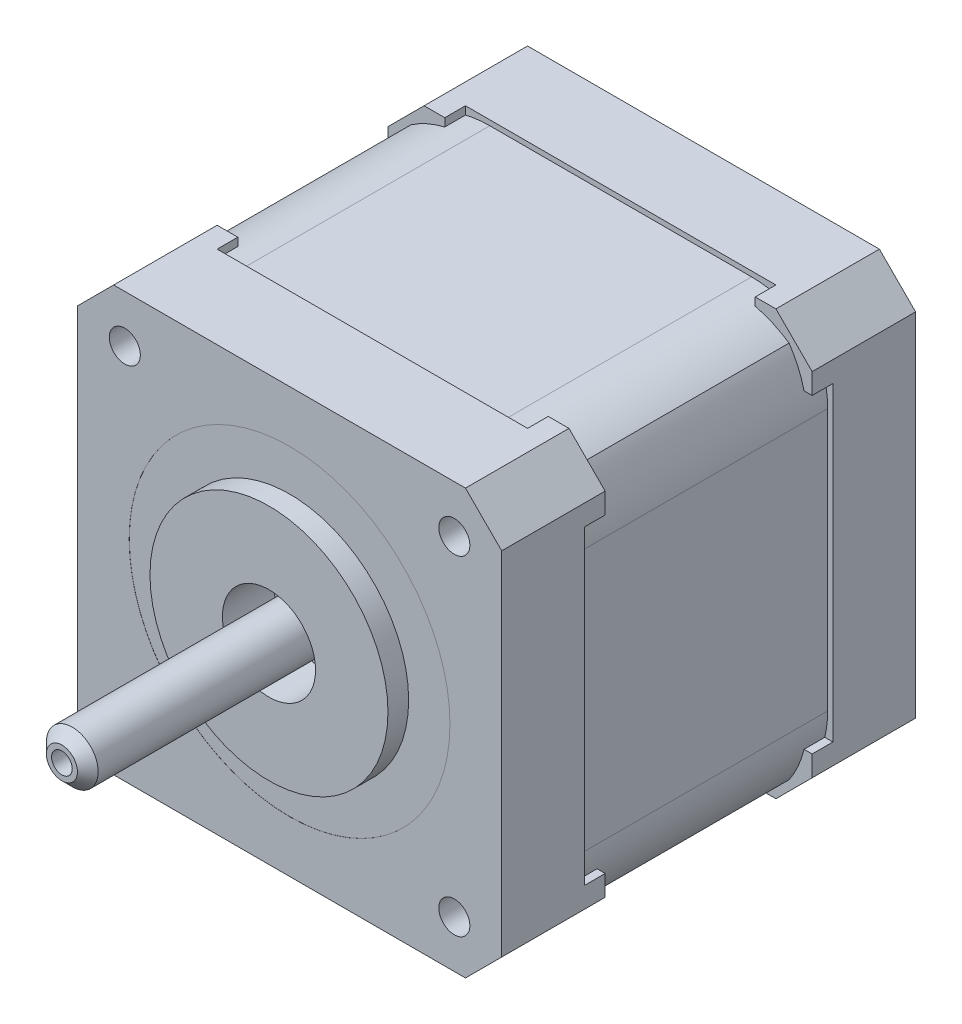
from build123d import *

# Parameters (mm, degrees)
Y_KSEKLIK_EKSTR_ZYON2_DEPTH  = 8
Y_KSEKLIK_EKSTR_ZYON10_DEPTH = 2
Y_KSEKLIK_EKSTR_ZYON11_DEPTH = 24
Y_KSEKLIK_EKSTR_ZYON12_DEPTH = 8
Y_KSEKLIK_EKSTR_ZYON14_DEPTH = 2
RADYUS5_R                    = 10
IZIM15_R                     = 4.5
KES_EKSTR_ZYON3_DEPTH        = 3
RADYUS6_R                    = 0.5
IZIM16_R                     = 3
Y_KSEKLIK_EKSTR_ZYON15_DEPTH = 1
RADYUS7_R                    = 0.5
KES_EKSTR_ZYON4_DEPTH        = 0.5
IZIM18_R                     = 3
KES_EKSTR_ZYON5_DEPTH        = 1
IZIM19_R                     = 2
Y_KSEKLIK_EKSTR_ZYON17_DEPTH = 0.5
RADYUS8_R                    = 0.5
KES_EKSTR_ZYON6_DEPTH        = 0.1
KES_EKSTR_ZYON7_START        = -3
IZIM22_R                     = 4.5
KES_EKSTR_ZYON7_DEPTH        = 3
IZIM23_R                     = 2.5
Y_KSEKLIK_EKSTR_ZYON18_DEPTH = 25
IZIM24_R                     = 1
KES_EKSTR_ZYON8_DEPTH        = 2
PAH1_SIZE                    = 1
KES_EKSTR_ZYON9_START        = -0.01
IZIM25_R                     = 15.5
IZIM25_R_2                   = 4.5
KES_EKSTR_ZYON9_DEPTH        = 0.01
IZIM26_R                     = 11.5
IZIM26_R_2                   = 4.5
Y_KSEKLIK_EKSTR_ZYON19_DEPTH = 2
IZIM28_R                     = 1.5
KES_EKSTR_ZYON10_DEPTH       = 6


# Some blends are built 0.0001 mm under size
with BuildPart() as part:
    # Çizim1 → Yükseklik-Ekstrüzyon2 (new body)
    with BuildSketch(Plane.XY):
        Polygon((-17, 41), (17, 41), (20.5, 37.5), (20.5, 3.5), (17, 0), (-17, 0), (-20.5, 3.5), (-20.5, 37.5), align=None)
    extrude(amount=Y_KSEKLIK_EKSTR_ZYON2_DEPTH)

    # Çizim5 → Yükseklik-Ekstrüzyon10 (add)
    with BuildSketch(Plane(origin=(0, 0, 0), x_dir=(-1, 0, 0), z_dir=(0, 0, -1))):
        Polygon((-20.5, 37.5), (-20.5, 35.5), (-20, 35.5), (-20, 37.292893219), (-16.792893219, 40.5), (-15, 40.5), (-15, 41), (-17, 41), align=None)
        Polygon((17, 41), (15, 41), (15, 40.5), (16.792893219, 40.5), (20, 37.292893219), (20, 35.5), (20.5, 35.5), (20.5, 37.5), align=None)
        Polygon((15, 0.5), (15, 0), (17, 0), (20.5, 3.5), (20.5, 5.5), (20, 5.5), (20, 3.707106781), (16.792893219, 0.5), align=None)
        Polygon((-20.5, 5.5), (-20.5, 3.5), (-17, 0), (-15, 0), (-15, 0.5), (-16.792893219, 0.5), (-20, 3.707106781), (-20, 5.5), align=None)
    extrude(amount=Y_KSEKLIK_EKSTR_ZYON10_DEPTH)

    # Çizim12 → Yükseklik-Ekstrüzyon11 (add)
    with BuildSketch(Plane(origin=(0, 0, 0), x_dir=(-1, 0, 0), z_dir=(0, 0, -1))):
        Polygon((-20, 37.292893219), (-20, 35.5), (-20, 5.5), (-20, 3.707106781), (-16.792893219, 0.5), (-15, 0.5), (15, 0.5), (16.792893219, 0.5), (20, 3.707106781), (20, 5.5), (20, 35.5), (20, 37.292893219), (16.792893219, 40.5), (15, 40.5), (-15, 40.5), (-16.792893219, 40.5), align=None)
    extrude(amount=Y_KSEKLIK_EKSTR_ZYON11_DEPTH)

    # Çizim13 → Yükseklik-Ekstrüzyon12 (add)
    with BuildSketch(Plane(origin=(0, 0, -24), x_dir=(-1, 0, 0), z_dir=(0, 0, -1))):
        Polygon((-17, 41), (-20.5, 37.5), (-20.5, 3.5), (-17, 0), (17, 0), (20.5, 3.5), (20.5, 37.5), (17, 41), align=None)
    extrude(amount=Y_KSEKLIK_EKSTR_ZYON12_DEPTH)

    # Çizim14 → Yükseklik-Ekstrüzyon14 (add)
    with BuildSketch(Plane.XY.offset(-24)):
        Polygon((-15, 40.5), (-15, 41), (-17, 41), (-20.5, 37.5), (-20.5, 35.5), (-20, 35.5), (-20, 37.292893219), (-16.792893219, 40.5), align=None)
        Polygon((-20, 5.5), (-20.5, 5.5), (-20.5, 3.5), (-17, 0), (-15, 0), (-15, 0.5), (-16.792893219, 0.5), (-20, 3.707106781), align=None)
        Polygon((20.5, 3.5), (20.5, 5.5), (20, 5.5), (20, 3.707106781), (16.792893219, 0.5), (15, 0.5), (15, 0), (17, 0), align=None)
        Polygon((20.5, 37.5), (17, 41), (15, 41), (15, 40.5), (16.792893219, 40.5), (20, 37.292893219), (20, 35.5), (20.5, 35.5), align=None)
    extrude(amount=Y_KSEKLIK_EKSTR_ZYON14_DEPTH)

    # Radyus5
    # the kernel refuses this fillet: 10 mm, written as the material it takes off along each edge
    with BuildSketch(Plane(origin=(-16.792893219, 0.5, 8.355339059), x_dir=(-0.7071067811865476, 0.7071067811865476, 0), z_dir=(0, 0, -1))) as radyus5_piece_1_section:
        with BuildLine():
            CenterArc((RADYUS5_R * 0.414213562373, RADYUS5_R), RADYUS5_R, 225, 45)
            Line((-RADYUS5_R * 0.292893218813, RADYUS5_R * 0.292893218813), (0, 0))
            Line((0, 0), (RADYUS5_R * 0.414213562373, 0))
        make_face()
    radyus5_piece_1 = extrude(amount=30.355339059, mode=Mode.PRIVATE)
    radyus5_piece_1 = split(radyus5_piece_1, bisect_by=Plane(origin=(-15, 0.458221374, -1), z_dir=(1, 0, 0)), keep=Keep.TOP, mode=Mode.PRIVATE)
    radyus5_piece_1 = split(radyus5_piece_1, bisect_by=Plane(origin=(-14.011989835, 0.458221374, -2), z_dir=(0, 0, 1)), keep=Keep.TOP, mode=Mode.PRIVATE)
    radyus5_piece_1 = split(radyus5_piece_1, bisect_by=Plane(origin=(-14.011989835, 0.458221374, 0), z_dir=(0, 0, -1)), keep=Keep.TOP, mode=Mode.PRIVATE)
    add(radyus5_piece_1, mode=Mode.SUBTRACT)
    with BuildSketch(Plane(origin=(-16.792893219, 0.5, -2), x_dir=(-0.7071067811865476, 0.7071067811865476, 0), z_dir=(0, 0, -1))) as radyus5_piece_2_section:
        with BuildLine():
            CenterArc((RADYUS5_R * 0.414213562373, RADYUS5_R), RADYUS5_R, 225, 45)
            Line((-RADYUS5_R * 0.292893218813, RADYUS5_R * 0.292893218813), (0, 0))
            Line((0, 0), (RADYUS5_R * 0.414213562373, 0))
        make_face()
    radyus5_piece_2 = extrude(amount=20, mode=Mode.PRIVATE)
    radyus5_piece_2 = split(radyus5_piece_2, bisect_by=Plane(origin=(-15, 1.262769888, -12), z_dir=(-1, 0, 0)), keep=Keep.TOP, mode=Mode.PRIVATE)
    add(radyus5_piece_2, mode=Mode.SUBTRACT)
    with BuildSketch(Plane(origin=(-16.792893219, 0.5, -2), x_dir=(-0.7071067811865476, 0.7071067811865476, 0), z_dir=(0, 0, -1))) as radyus5_piece_3_section:
        with BuildLine():
            CenterArc((RADYUS5_R * 0.414213562373, RADYUS5_R), RADYUS5_R, 225, 45)
            Line((-RADYUS5_R * 0.292893218813, RADYUS5_R * 0.292893218813), (0, 0))
            Line((0, 0), (RADYUS5_R * 0.414213562373, 0))
        make_face()
    radyus5_piece_3 = extrude(amount=20, mode=Mode.PRIVATE)
    radyus5_piece_3 = split(radyus5_piece_3, bisect_by=Plane(origin=(-15, 0.458221374, -12), z_dir=(1, 0, 0)), keep=Keep.TOP, mode=Mode.PRIVATE)
    add(radyus5_piece_3, mode=Mode.SUBTRACT)
    with BuildSketch(Plane(origin=(-16.792893219, 0.5, -2), x_dir=(-0.7071067811865476, 0.7071067811865476, 0), z_dir=(0, 0, -1))) as radyus5_piece_4_section:
        with BuildLine():
            CenterArc((RADYUS5_R * 0.414213562373, RADYUS5_R), RADYUS5_R, 225, 45)
            Line((-RADYUS5_R * 0.292893218813, RADYUS5_R * 0.292893218813), (0, 0))
            Line((0, 0), (RADYUS5_R * 0.414213562373, 0))
        make_face()
    radyus5_piece_4 = extrude(amount=30.355339059, mode=Mode.PRIVATE)
    radyus5_piece_4 = split(radyus5_piece_4, bisect_by=Plane(origin=(-14.011989835, 0.458221374, -24), z_dir=(0, 0, 1)), keep=Keep.TOP, mode=Mode.PRIVATE)
    radyus5_piece_4 = split(radyus5_piece_4, bisect_by=Plane(origin=(-15, 0.458221374, -23), z_dir=(1, 0, 0)), keep=Keep.TOP, mode=Mode.PRIVATE)
    radyus5_piece_4 = split(radyus5_piece_4, bisect_by=Plane(origin=(-14.011989835, 0.458221374, -22), z_dir=(0, 0, -1)), keep=Keep.TOP, mode=Mode.PRIVATE)
    add(radyus5_piece_4, mode=Mode.SUBTRACT)
    with BuildSketch(Plane(origin=(-20, 3.707106781, 8.355339059), x_dir=(0, 1, 0), z_dir=(0, 0, -1))) as radyus5_piece_5_section:
        with BuildLine():
            CenterArc((RADYUS5_R * 0.414213562373, RADYUS5_R), RADYUS5_R, 225, 45)
            Line((-RADYUS5_R * 0.292893218813, RADYUS5_R * 0.292893218813), (0, 0))
            Line((0, 0), (RADYUS5_R * 0.414213562373, 0))
        make_face()
    radyus5_piece_5 = extrude(amount=30.355339059, mode=Mode.PRIVATE)
    radyus5_piece_5 = split(radyus5_piece_5, bisect_by=Plane(origin=(-20.041778626, 6.488010165, -2), z_dir=(0, 0, 1)), keep=Keep.TOP, mode=Mode.PRIVATE)
    radyus5_piece_5 = split(radyus5_piece_5, bisect_by=Plane(origin=(-20.041778626, 5.5, -1), z_dir=(0, 1, 0)), keep=Keep.TOP, mode=Mode.PRIVATE)
    radyus5_piece_5 = split(radyus5_piece_5, bisect_by=Plane(origin=(-20.041778626, 6.488010165, 0), z_dir=(0, 0, -1)), keep=Keep.TOP, mode=Mode.PRIVATE)
    add(radyus5_piece_5, mode=Mode.SUBTRACT)
    with BuildSketch(Plane(origin=(-20, 3.707106781, -2), x_dir=(0, 1, 0), z_dir=(0, 0, -1))) as radyus5_piece_6_section:
        with BuildLine():
            CenterArc((RADYUS5_R * 0.414213562373, RADYUS5_R), RADYUS5_R, 225, 45)
            Line((-RADYUS5_R * 0.292893218813, RADYUS5_R * 0.292893218813), (0, 0))
            Line((0, 0), (RADYUS5_R * 0.414213562373, 0))
        make_face()
    radyus5_piece_6 = extrude(amount=20, mode=Mode.PRIVATE)
    radyus5_piece_6 = split(radyus5_piece_6, bisect_by=Plane(origin=(-20.041778626, 5.5, -12), z_dir=(0, 1, 0)), keep=Keep.TOP, mode=Mode.PRIVATE)
    add(radyus5_piece_6, mode=Mode.SUBTRACT)
    with BuildSketch(Plane(origin=(-20, 3.707106781, -2), x_dir=(0, 1, 0), z_dir=(0, 0, -1))) as radyus5_piece_7_section:
        with BuildLine():
            CenterArc((RADYUS5_R * 0.414213562373, RADYUS5_R), RADYUS5_R, 225, 45)
            Line((-RADYUS5_R * 0.292893218813, RADYUS5_R * 0.292893218813), (0, 0))
            Line((0, 0), (RADYUS5_R * 0.414213562373, 0))
        make_face()
    radyus5_piece_7 = extrude(amount=20, mode=Mode.PRIVATE)
    radyus5_piece_7 = split(radyus5_piece_7, bisect_by=Plane(origin=(-19.237230112, 5.5, -12), z_dir=(0, -1, 0)), keep=Keep.TOP, mode=Mode.PRIVATE)
    add(radyus5_piece_7, mode=Mode.SUBTRACT)
    with BuildSketch(Plane(origin=(-20, 3.707106781, -2), x_dir=(0, 1, 0), z_dir=(0, 0, -1))) as radyus5_piece_8_section:
        with BuildLine():
            CenterArc((RADYUS5_R * 0.414213562373, RADYUS5_R), RADYUS5_R, 225, 45)
            Line((-RADYUS5_R * 0.292893218813, RADYUS5_R * 0.292893218813), (0, 0))
            Line((0, 0), (RADYUS5_R * 0.414213562373, 0))
        make_face()
    radyus5_piece_8 = extrude(amount=30.355339059, mode=Mode.PRIVATE)
    radyus5_piece_8 = split(radyus5_piece_8, bisect_by=Plane(origin=(-20.041778626, 6.488010165, -22), z_dir=(0, 0, -1)), keep=Keep.TOP, mode=Mode.PRIVATE)
    radyus5_piece_8 = split(radyus5_piece_8, bisect_by=Plane(origin=(-20.041778626, 6.488010165, -24), z_dir=(0, 0, 1)), keep=Keep.TOP, mode=Mode.PRIVATE)
    radyus5_piece_8 = split(radyus5_piece_8, bisect_by=Plane(origin=(-20.041778626, 5.5, -23), z_dir=(0, 1, 0)), keep=Keep.TOP, mode=Mode.PRIVATE)
    add(radyus5_piece_8, mode=Mode.SUBTRACT)
    with BuildSketch(Plane(origin=(-20, 37.292893219, 8.355339059), x_dir=(0.7071067811865476, 0.7071067811865476, 0), z_dir=(0, 0, -1))) as radyus5_piece_9_section:
        with BuildLine():
            CenterArc((RADYUS5_R * 0.414213562373, RADYUS5_R), RADYUS5_R, 225, 45)
            Line((-RADYUS5_R * 0.292893218813, RADYUS5_R * 0.292893218813), (0, 0))
            Line((0, 0), (RADYUS5_R * 0.414213562373, 0))
        make_face()
    radyus5_piece_9 = extrude(amount=30.355339059, mode=Mode.PRIVATE)
    radyus5_piece_9 = split(radyus5_piece_9, bisect_by=Plane(origin=(-20.041778626, 35.5, -1), z_dir=(0, -1, 0)), keep=Keep.TOP, mode=Mode.PRIVATE)
    radyus5_piece_9 = split(radyus5_piece_9, bisect_by=Plane(origin=(-20.041778626, 34.511989835, -2), z_dir=(0, 0, 1)), keep=Keep.TOP, mode=Mode.PRIVATE)
    radyus5_piece_9 = split(radyus5_piece_9, bisect_by=Plane(origin=(-20.041778626, 34.511989835, 0), z_dir=(0, 0, -1)), keep=Keep.TOP, mode=Mode.PRIVATE)
    add(radyus5_piece_9, mode=Mode.SUBTRACT)
    with BuildSketch(Plane(origin=(-20, 37.292893219, -2), x_dir=(0.7071067811865476, 0.7071067811865476, 0), z_dir=(0, 0, -1))) as radyus5_piece_10_section:
        with BuildLine():
            CenterArc((RADYUS5_R * 0.414213562373, RADYUS5_R), RADYUS5_R, 225, 45)
            Line((-RADYUS5_R * 0.292893218813, RADYUS5_R * 0.292893218813), (0, 0))
            Line((0, 0), (RADYUS5_R * 0.414213562373, 0))
        make_face()
    radyus5_piece_10 = extrude(amount=20, mode=Mode.PRIVATE)
    radyus5_piece_10 = split(radyus5_piece_10, bisect_by=Plane(origin=(-19.237230112, 35.5, -12), z_dir=(0, 1, 0)), keep=Keep.TOP, mode=Mode.PRIVATE)
    add(radyus5_piece_10, mode=Mode.SUBTRACT)
    with BuildSketch(Plane(origin=(-20, 37.292893219, -2), x_dir=(0.7071067811865476, 0.7071067811865476, 0), z_dir=(0, 0, -1))) as radyus5_piece_11_section:
        with BuildLine():
            CenterArc((RADYUS5_R * 0.414213562373, RADYUS5_R), RADYUS5_R, 225, 45)
            Line((-RADYUS5_R * 0.292893218813, RADYUS5_R * 0.292893218813), (0, 0))
            Line((0, 0), (RADYUS5_R * 0.414213562373, 0))
        make_face()
    radyus5_piece_11 = extrude(amount=20, mode=Mode.PRIVATE)
    radyus5_piece_11 = split(radyus5_piece_11, bisect_by=Plane(origin=(-20.041778626, 35.5, -12), z_dir=(0, -1, 0)), keep=Keep.TOP, mode=Mode.PRIVATE)
    add(radyus5_piece_11, mode=Mode.SUBTRACT)
    with BuildSketch(Plane(origin=(-20, 37.292893219, -2), x_dir=(0.7071067811865476, 0.7071067811865476, 0), z_dir=(0, 0, -1))) as radyus5_piece_12_section:
        with BuildLine():
            CenterArc((RADYUS5_R * 0.414213562373, RADYUS5_R), RADYUS5_R, 225, 45)
            Line((-RADYUS5_R * 0.292893218813, RADYUS5_R * 0.292893218813), (0, 0))
            Line((0, 0), (RADYUS5_R * 0.414213562373, 0))
        make_face()
    radyus5_piece_12 = extrude(amount=30.355339059, mode=Mode.PRIVATE)
    radyus5_piece_12 = split(radyus5_piece_12, bisect_by=Plane(origin=(-20.041778626, 34.511989835, -24), z_dir=(0, 0, 1)), keep=Keep.TOP, mode=Mode.PRIVATE)
    radyus5_piece_12 = split(radyus5_piece_12, bisect_by=Plane(origin=(-20.041778626, 35.5, -23), z_dir=(0, -1, 0)), keep=Keep.TOP, mode=Mode.PRIVATE)
    radyus5_piece_12 = split(radyus5_piece_12, bisect_by=Plane(origin=(-20.041778626, 34.511989835, -22), z_dir=(0, 0, -1)), keep=Keep.TOP, mode=Mode.PRIVATE)
    add(radyus5_piece_12, mode=Mode.SUBTRACT)
    with BuildSketch(Plane(origin=(-16.792893219, 40.5, 8.355339059), x_dir=(-0.7071067811865476, -0.7071067811865476, 0), z_dir=(0, 0, -1))) as radyus5_piece_13_section:
        with BuildLine():
            CenterArc((RADYUS5_R * 0.414213562373, -RADYUS5_R), RADYUS5_R, 90, 45)
            Line((-RADYUS5_R * 0.292893218813, -RADYUS5_R * 0.292893218813), (0, 0))
            Line((0, 0), (RADYUS5_R * 0.414213562373, 0))
        make_face()
    radyus5_piece_13 = extrude(amount=30.355339059, mode=Mode.PRIVATE)
    radyus5_piece_13 = split(radyus5_piece_13, bisect_by=Plane(origin=(-14.011989835, 40.541778626, -2), z_dir=(0, 0, 1)), keep=Keep.TOP, mode=Mode.PRIVATE)
    radyus5_piece_13 = split(radyus5_piece_13, bisect_by=Plane(origin=(-14.011989835, 40.541778626, 0), z_dir=(0, 0, -1)), keep=Keep.TOP, mode=Mode.PRIVATE)
    radyus5_piece_13 = split(radyus5_piece_13, bisect_by=Plane(origin=(-15, 40.541778626, -1), z_dir=(1, 0, 0)), keep=Keep.TOP, mode=Mode.PRIVATE)
    add(radyus5_piece_13, mode=Mode.SUBTRACT)
    with BuildSketch(Plane(origin=(-16.792893219, 40.5, -2), x_dir=(-0.7071067811865476, -0.7071067811865476, 0), z_dir=(0, 0, -1))) as radyus5_piece_14_section:
        with BuildLine():
            CenterArc((RADYUS5_R * 0.414213562373, -RADYUS5_R), RADYUS5_R, 90, 45)
            Line((-RADYUS5_R * 0.292893218813, -RADYUS5_R * 0.292893218813), (0, 0))
            Line((0, 0), (RADYUS5_R * 0.414213562373, 0))
        make_face()
    radyus5_piece_14 = extrude(amount=20, mode=Mode.PRIVATE)
    radyus5_piece_14 = split(radyus5_piece_14, bisect_by=Plane(origin=(-15, 39.737230112, -12), z_dir=(-1, 0, 0)), keep=Keep.TOP, mode=Mode.PRIVATE)
    add(radyus5_piece_14, mode=Mode.SUBTRACT)
    with BuildSketch(Plane(origin=(-16.792893219, 40.5, -2), x_dir=(-0.7071067811865476, -0.7071067811865476, 0), z_dir=(0, 0, -1))) as radyus5_piece_15_section:
        with BuildLine():
            CenterArc((RADYUS5_R * 0.414213562373, -RADYUS5_R), RADYUS5_R, 90, 45)
            Line((-RADYUS5_R * 0.292893218813, -RADYUS5_R * 0.292893218813), (0, 0))
            Line((0, 0), (RADYUS5_R * 0.414213562373, 0))
        make_face()
    radyus5_piece_15 = extrude(amount=20, mode=Mode.PRIVATE)
    radyus5_piece_15 = split(radyus5_piece_15, bisect_by=Plane(origin=(-15, 40.541778626, -12), z_dir=(1, 0, 0)), keep=Keep.TOP, mode=Mode.PRIVATE)
    add(radyus5_piece_15, mode=Mode.SUBTRACT)
    with BuildSketch(Plane(origin=(-16.792893219, 40.5, -2), x_dir=(-0.7071067811865476, -0.7071067811865476, 0), z_dir=(0, 0, -1))) as radyus5_piece_16_section:
        with BuildLine():
            CenterArc((RADYUS5_R * 0.414213562373, -RADYUS5_R), RADYUS5_R, 90, 45)
            Line((-RADYUS5_R * 0.292893218813, -RADYUS5_R * 0.292893218813), (0, 0))
            Line((0, 0), (RADYUS5_R * 0.414213562373, 0))
        make_face()
    radyus5_piece_16 = extrude(amount=30.355339059, mode=Mode.PRIVATE)
    radyus5_piece_16 = split(radyus5_piece_16, bisect_by=Plane(origin=(-14.011989835, 40.541778626, -22), z_dir=(0, 0, -1)), keep=Keep.TOP, mode=Mode.PRIVATE)
    radyus5_piece_16 = split(radyus5_piece_16, bisect_by=Plane(origin=(-15, 40.541778626, -23), z_dir=(1, 0, 0)), keep=Keep.TOP, mode=Mode.PRIVATE)
    radyus5_piece_16 = split(radyus5_piece_16, bisect_by=Plane(origin=(-14.011989835, 40.541778626, -24), z_dir=(0, 0, 1)), keep=Keep.TOP, mode=Mode.PRIVATE)
    add(radyus5_piece_16, mode=Mode.SUBTRACT)
    with BuildSketch(Plane(origin=(20, 37.292893219, 8.355339059), x_dir=(0, -1, 0), z_dir=(0, 0, -1))) as radyus5_piece_17_section:
        with BuildLine():
            CenterArc((RADYUS5_R * 0.414213562373, RADYUS5_R), RADYUS5_R, 225, 45)
            Line((-RADYUS5_R * 0.292893218813, RADYUS5_R * 0.292893218813), (0, 0))
            Line((0, 0), (RADYUS5_R * 0.414213562373, 0))
        make_face()
    radyus5_piece_17 = extrude(amount=30.355339059, mode=Mode.PRIVATE)
    radyus5_piece_17 = split(radyus5_piece_17, bisect_by=Plane(origin=(20.041778626, 35.5, -1), z_dir=(0, -1, 0)), keep=Keep.TOP, mode=Mode.PRIVATE)
    radyus5_piece_17 = split(radyus5_piece_17, bisect_by=Plane(origin=(20.041778626, 34.511989835, 0), z_dir=(0, 0, -1)), keep=Keep.TOP, mode=Mode.PRIVATE)
    radyus5_piece_17 = split(radyus5_piece_17, bisect_by=Plane(origin=(20.041778626, 34.511989835, -2), z_dir=(0, 0, 1)), keep=Keep.TOP, mode=Mode.PRIVATE)
    add(radyus5_piece_17, mode=Mode.SUBTRACT)
    with BuildSketch(Plane(origin=(20, 37.292893219, -2), x_dir=(0, -1, 0), z_dir=(0, 0, -1))) as radyus5_piece_18_section:
        with BuildLine():
            CenterArc((RADYUS5_R * 0.414213562373, RADYUS5_R), RADYUS5_R, 225, 45)
            Line((-RADYUS5_R * 0.292893218813, RADYUS5_R * 0.292893218813), (0, 0))
            Line((0, 0), (RADYUS5_R * 0.414213562373, 0))
        make_face()
    radyus5_piece_18 = extrude(amount=20, mode=Mode.PRIVATE)
    radyus5_piece_18 = split(radyus5_piece_18, bisect_by=Plane(origin=(20.041778626, 35.5, -12), z_dir=(0, -1, 0)), keep=Keep.TOP, mode=Mode.PRIVATE)
    add(radyus5_piece_18, mode=Mode.SUBTRACT)
    with BuildSketch(Plane(origin=(20, 37.292893219, -2), x_dir=(0, -1, 0), z_dir=(0, 0, -1))) as radyus5_piece_19_section:
        with BuildLine():
            CenterArc((RADYUS5_R * 0.414213562373, RADYUS5_R), RADYUS5_R, 225, 45)
            Line((-RADYUS5_R * 0.292893218813, RADYUS5_R * 0.292893218813), (0, 0))
            Line((0, 0), (RADYUS5_R * 0.414213562373, 0))
        make_face()
    radyus5_piece_19 = extrude(amount=20, mode=Mode.PRIVATE)
    radyus5_piece_19 = split(radyus5_piece_19, bisect_by=Plane(origin=(19.237230112, 35.5, -12), z_dir=(0, 1, 0)), keep=Keep.TOP, mode=Mode.PRIVATE)
    add(radyus5_piece_19, mode=Mode.SUBTRACT)
    with BuildSketch(Plane(origin=(20, 37.292893219, -2), x_dir=(0, -1, 0), z_dir=(0, 0, -1))) as radyus5_piece_20_section:
        with BuildLine():
            CenterArc((RADYUS5_R * 0.414213562373, RADYUS5_R), RADYUS5_R, 225, 45)
            Line((-RADYUS5_R * 0.292893218813, RADYUS5_R * 0.292893218813), (0, 0))
            Line((0, 0), (RADYUS5_R * 0.414213562373, 0))
        make_face()
    radyus5_piece_20 = extrude(amount=30.355339059, mode=Mode.PRIVATE)
    radyus5_piece_20 = split(radyus5_piece_20, bisect_by=Plane(origin=(20.041778626, 34.511989835, -22), z_dir=(0, 0, -1)), keep=Keep.TOP, mode=Mode.PRIVATE)
    radyus5_piece_20 = split(radyus5_piece_20, bisect_by=Plane(origin=(20.041778626, 35.5, -23), z_dir=(0, -1, 0)), keep=Keep.TOP, mode=Mode.PRIVATE)
    radyus5_piece_20 = split(radyus5_piece_20, bisect_by=Plane(origin=(20.041778626, 34.511989835, -24), z_dir=(0, 0, 1)), keep=Keep.TOP, mode=Mode.PRIVATE)
    add(radyus5_piece_20, mode=Mode.SUBTRACT)
    with BuildSketch(Plane(origin=(16.792893219, 40.5, 8.355339059), x_dir=(0.7071067811865485, -0.7071067811865467, 0), z_dir=(0, 0, -1))) as radyus5_piece_21_section:
        with BuildLine():
            CenterArc((RADYUS5_R * 0.414213562373, RADYUS5_R), RADYUS5_R, 225, 45)
            Line((-RADYUS5_R * 0.292893218813, RADYUS5_R * 0.292893218813), (0, 0))
            Line((0, 0), (RADYUS5_R * 0.414213562373, 0))
        make_face()
    radyus5_piece_21 = extrude(amount=30.355339059, mode=Mode.PRIVATE)
    radyus5_piece_21 = split(radyus5_piece_21, bisect_by=Plane(origin=(14.011989835, 40.541778626, -2), z_dir=(0, 0, 1)), keep=Keep.TOP, mode=Mode.PRIVATE)
    radyus5_piece_21 = split(radyus5_piece_21, bisect_by=Plane(origin=(15, 40.541778626, -1), z_dir=(-1, 0, 0)), keep=Keep.TOP, mode=Mode.PRIVATE)
    radyus5_piece_21 = split(radyus5_piece_21, bisect_by=Plane(origin=(14.011989835, 40.541778626, 0), z_dir=(0, 0, -1)), keep=Keep.TOP, mode=Mode.PRIVATE)
    add(radyus5_piece_21, mode=Mode.SUBTRACT)
    with BuildSketch(Plane(origin=(16.792893219, 40.5, -2), x_dir=(0.7071067811865485, -0.7071067811865467, 0), z_dir=(0, 0, -1))) as radyus5_piece_22_section:
        with BuildLine():
            CenterArc((RADYUS5_R * 0.414213562373, RADYUS5_R), RADYUS5_R, 225, 45)
            Line((-RADYUS5_R * 0.292893218813, RADYUS5_R * 0.292893218813), (0, 0))
            Line((0, 0), (RADYUS5_R * 0.414213562373, 0))
        make_face()
    radyus5_piece_22 = extrude(amount=20, mode=Mode.PRIVATE)
    radyus5_piece_22 = split(radyus5_piece_22, bisect_by=Plane(origin=(15, 39.737230112, -12), z_dir=(1, 0, 0)), keep=Keep.TOP, mode=Mode.PRIVATE)
    add(radyus5_piece_22, mode=Mode.SUBTRACT)
    with BuildSketch(Plane(origin=(16.792893219, 40.5, -2), x_dir=(0.7071067811865485, -0.7071067811865467, 0), z_dir=(0, 0, -1))) as radyus5_piece_23_section:
        with BuildLine():
            CenterArc((RADYUS5_R * 0.414213562373, RADYUS5_R), RADYUS5_R, 225, 45)
            Line((-RADYUS5_R * 0.292893218813, RADYUS5_R * 0.292893218813), (0, 0))
            Line((0, 0), (RADYUS5_R * 0.414213562373, 0))
        make_face()
    radyus5_piece_23 = extrude(amount=20, mode=Mode.PRIVATE)
    radyus5_piece_23 = split(radyus5_piece_23, bisect_by=Plane(origin=(15, 40.541778626, -12), z_dir=(-1, 0, 0)), keep=Keep.TOP, mode=Mode.PRIVATE)
    add(radyus5_piece_23, mode=Mode.SUBTRACT)
    with BuildSketch(Plane(origin=(16.792893219, 40.5, -2), x_dir=(0.7071067811865485, -0.7071067811865467, 0), z_dir=(0, 0, -1))) as radyus5_piece_24_section:
        with BuildLine():
            CenterArc((RADYUS5_R * 0.414213562373, RADYUS5_R), RADYUS5_R, 225, 45)
            Line((-RADYUS5_R * 0.292893218813, RADYUS5_R * 0.292893218813), (0, 0))
            Line((0, 0), (RADYUS5_R * 0.414213562373, 0))
        make_face()
    radyus5_piece_24 = extrude(amount=30.355339059, mode=Mode.PRIVATE)
    radyus5_piece_24 = split(radyus5_piece_24, bisect_by=Plane(origin=(14.011989835, 40.541778626, -22), z_dir=(0, 0, -1)), keep=Keep.TOP, mode=Mode.PRIVATE)
    radyus5_piece_24 = split(radyus5_piece_24, bisect_by=Plane(origin=(15, 40.541778626, -23), z_dir=(-1, 0, 0)), keep=Keep.TOP, mode=Mode.PRIVATE)
    radyus5_piece_24 = split(radyus5_piece_24, bisect_by=Plane(origin=(14.011989835, 40.541778626, -24), z_dir=(0, 0, 1)), keep=Keep.TOP, mode=Mode.PRIVATE)
    add(radyus5_piece_24, mode=Mode.SUBTRACT)
    with BuildSketch(Plane(origin=(20, 3.707106781, 8.355339059), x_dir=(-0.7071067811865475, -0.7071067811865478, 0), z_dir=(0, 0, -1))) as radyus5_piece_25_section:
        with BuildLine():
            CenterArc((RADYUS5_R * 0.414213562373, RADYUS5_R), RADYUS5_R, 225, 45)
            Line((-RADYUS5_R * 0.292893218813, RADYUS5_R * 0.292893218813), (0, 0))
            Line((0, 0), (RADYUS5_R * 0.414213562373, 0))
        make_face()
    radyus5_piece_25 = extrude(amount=30.355339059, mode=Mode.PRIVATE)
    radyus5_piece_25 = split(radyus5_piece_25, bisect_by=Plane(origin=(20.041778626, 5.5, -1), z_dir=(0, 1, 0)), keep=Keep.TOP, mode=Mode.PRIVATE)
    radyus5_piece_25 = split(radyus5_piece_25, bisect_by=Plane(origin=(20.041778626, 6.488010165, -2), z_dir=(0, 0, 1)), keep=Keep.TOP, mode=Mode.PRIVATE)
    radyus5_piece_25 = split(radyus5_piece_25, bisect_by=Plane(origin=(20.041778626, 6.488010165, 0), z_dir=(0, 0, -1)), keep=Keep.TOP, mode=Mode.PRIVATE)
    add(radyus5_piece_25, mode=Mode.SUBTRACT)
    with BuildSketch(Plane(origin=(20, 3.707106781, -2), x_dir=(-0.7071067811865475, -0.7071067811865478, 0), z_dir=(0, 0, -1))) as radyus5_piece_26_section:
        with BuildLine():
            CenterArc((RADYUS5_R * 0.414213562373, RADYUS5_R), RADYUS5_R, 225, 45)
            Line((-RADYUS5_R * 0.292893218813, RADYUS5_R * 0.292893218813), (0, 0))
            Line((0, 0), (RADYUS5_R * 0.414213562373, 0))
        make_face()
    radyus5_piece_26 = extrude(amount=20, mode=Mode.PRIVATE)
    radyus5_piece_26 = split(radyus5_piece_26, bisect_by=Plane(origin=(19.237230112, 5.5, -12), z_dir=(0, -1, 0)), keep=Keep.TOP, mode=Mode.PRIVATE)
    add(radyus5_piece_26, mode=Mode.SUBTRACT)
    with BuildSketch(Plane(origin=(20, 3.707106781, -2), x_dir=(-0.7071067811865475, -0.7071067811865478, 0), z_dir=(0, 0, -1))) as radyus5_piece_27_section:
        with BuildLine():
            CenterArc((RADYUS5_R * 0.414213562373, RADYUS5_R), RADYUS5_R, 225, 45)
            Line((-RADYUS5_R * 0.292893218813, RADYUS5_R * 0.292893218813), (0, 0))
            Line((0, 0), (RADYUS5_R * 0.414213562373, 0))
        make_face()
    radyus5_piece_27 = extrude(amount=20, mode=Mode.PRIVATE)
    radyus5_piece_27 = split(radyus5_piece_27, bisect_by=Plane(origin=(20.041778626, 5.5, -12), z_dir=(0, 1, 0)), keep=Keep.TOP, mode=Mode.PRIVATE)
    add(radyus5_piece_27, mode=Mode.SUBTRACT)
    with BuildSketch(Plane(origin=(20, 3.707106781, -2), x_dir=(-0.7071067811865475, -0.7071067811865478, 0), z_dir=(0, 0, -1))) as radyus5_piece_28_section:
        with BuildLine():
            CenterArc((RADYUS5_R * 0.414213562373, RADYUS5_R), RADYUS5_R, 225, 45)
            Line((-RADYUS5_R * 0.292893218813, RADYUS5_R * 0.292893218813), (0, 0))
            Line((0, 0), (RADYUS5_R * 0.414213562373, 0))
        make_face()
    radyus5_piece_28 = extrude(amount=30.355339059, mode=Mode.PRIVATE)
    radyus5_piece_28 = split(radyus5_piece_28, bisect_by=Plane(origin=(20.041778626, 6.488010165, -24), z_dir=(0, 0, 1)), keep=Keep.TOP, mode=Mode.PRIVATE)
    radyus5_piece_28 = split(radyus5_piece_28, bisect_by=Plane(origin=(20.041778626, 5.5, -23), z_dir=(0, 1, 0)), keep=Keep.TOP, mode=Mode.PRIVATE)
    radyus5_piece_28 = split(radyus5_piece_28, bisect_by=Plane(origin=(20.041778626, 6.488010165, -22), z_dir=(0, 0, -1)), keep=Keep.TOP, mode=Mode.PRIVATE)
    add(radyus5_piece_28, mode=Mode.SUBTRACT)
    with BuildSketch(Plane(origin=(16.792893219, 0.5, 8.355339059), x_dir=(-1, 0, 0), z_dir=(0, 0, -1))) as radyus5_piece_29_section:
        with BuildLine():
            CenterArc((RADYUS5_R * 0.414213562373, RADYUS5_R), RADYUS5_R, 225, 45)
            Line((-RADYUS5_R * 0.292893218813, RADYUS5_R * 0.292893218813), (0, 0))
            Line((0, 0), (RADYUS5_R * 0.414213562373, 0))
        make_face()
    radyus5_piece_29 = extrude(amount=30.355339059, mode=Mode.PRIVATE)
    radyus5_piece_29 = split(radyus5_piece_29, bisect_by=Plane(origin=(14.011989835, 0.458221374, 0), z_dir=(0, 0, -1)), keep=Keep.TOP, mode=Mode.PRIVATE)
    radyus5_piece_29 = split(radyus5_piece_29, bisect_by=Plane(origin=(15, 0.458221374, -1), z_dir=(-1, 0, 0)), keep=Keep.TOP, mode=Mode.PRIVATE)
    radyus5_piece_29 = split(radyus5_piece_29, bisect_by=Plane(origin=(14.011989835, 0.458221374, -2), z_dir=(0, 0, 1)), keep=Keep.TOP, mode=Mode.PRIVATE)
    add(radyus5_piece_29, mode=Mode.SUBTRACT)
    with BuildSketch(Plane(origin=(16.792893219, 0.5, -2), x_dir=(-1, 0, 0), z_dir=(0, 0, -1))) as radyus5_piece_30_section:
        with BuildLine():
            CenterArc((RADYUS5_R * 0.414213562373, RADYUS5_R), RADYUS5_R, 225, 45)
            Line((-RADYUS5_R * 0.292893218813, RADYUS5_R * 0.292893218813), (0, 0))
            Line((0, 0), (RADYUS5_R * 0.414213562373, 0))
        make_face()
    radyus5_piece_30 = extrude(amount=20, mode=Mode.PRIVATE)
    radyus5_piece_30 = split(radyus5_piece_30, bisect_by=Plane(origin=(15, 0.458221374, -12), z_dir=(-1, 0, 0)), keep=Keep.TOP, mode=Mode.PRIVATE)
    add(radyus5_piece_30, mode=Mode.SUBTRACT)
    with BuildSketch(Plane(origin=(16.792893219, 0.5, -2), x_dir=(-1, 0, 0), z_dir=(0, 0, -1))) as radyus5_piece_31_section:
        with BuildLine():
            CenterArc((RADYUS5_R * 0.414213562373, RADYUS5_R), RADYUS5_R, 225, 45)
            Line((-RADYUS5_R * 0.292893218813, RADYUS5_R * 0.292893218813), (0, 0))
            Line((0, 0), (RADYUS5_R * 0.414213562373, 0))
        make_face()
    radyus5_piece_31 = extrude(amount=20, mode=Mode.PRIVATE)
    radyus5_piece_31 = split(radyus5_piece_31, bisect_by=Plane(origin=(15, 1.262769888, -12), z_dir=(1, 0, 0)), keep=Keep.TOP, mode=Mode.PRIVATE)
    add(radyus5_piece_31, mode=Mode.SUBTRACT)
    with BuildSketch(Plane(origin=(16.792893219, 0.5, -2), x_dir=(-1, 0, 0), z_dir=(0, 0, -1))) as radyus5_piece_32_section:
        with BuildLine():
            CenterArc((RADYUS5_R * 0.414213562373, RADYUS5_R), RADYUS5_R, 225, 45)
            Line((-RADYUS5_R * 0.292893218813, RADYUS5_R * 0.292893218813), (0, 0))
            Line((0, 0), (RADYUS5_R * 0.414213562373, 0))
        make_face()
    radyus5_piece_32 = extrude(amount=30.355339059, mode=Mode.PRIVATE)
    radyus5_piece_32 = split(radyus5_piece_32, bisect_by=Plane(origin=(14.011989835, 0.458221374, -22), z_dir=(0, 0, -1)), keep=Keep.TOP, mode=Mode.PRIVATE)
    radyus5_piece_32 = split(radyus5_piece_32, bisect_by=Plane(origin=(14.011989835, 0.458221374, -24), z_dir=(0, 0, 1)), keep=Keep.TOP, mode=Mode.PRIVATE)
    radyus5_piece_32 = split(radyus5_piece_32, bisect_by=Plane(origin=(15, 0.458221374, -23), z_dir=(-1, 0, 0)), keep=Keep.TOP, mode=Mode.PRIVATE)
    add(radyus5_piece_32, mode=Mode.SUBTRACT)

    # Çizim15 → Kes-Ekstrüzyon3 (cut)
    with BuildSketch(Plane(origin=(0, 0, -32), x_dir=(-1, 0, 0), z_dir=(0, 0, -1))):
        with Locations((0, 20.5)):
            Circle(IZIM15_R)
    extrude(amount=-KES_EKSTR_ZYON3_DEPTH, mode=Mode.SUBTRACT)

    # Radyus6
    radyus6_edges = [part.edges().sort_by_distance(p)[0] for p in [
        (4.5, 20.5, -32),
    ]]
    fillet(radyus6_edges, radius=RADYUS6_R)

    # Çizim16 → Yükseklik-Ekstrüzyon15 (add)
    with BuildSketch(Plane(origin=(0, 0, -29), x_dir=(-1, 0, 0), z_dir=(0, 0, -1))):
        with Locations((0, 20.5)):
            Circle(IZIM16_R)
    extrude(amount=Y_KSEKLIK_EKSTR_ZYON15_DEPTH)

    # Radyus7
    radyus7_edges = [part.edges().sort_by_distance(p)[0] for p in [
        (3, 20.5, -30),
    ]]
    fillet(radyus7_edges, radius=RADYUS7_R)

    # Çizim17 → Kes-Ekstrüzyon4 (cut)
    with BuildSketch(Plane(origin=(0, 0, -30), x_dir=(-1, 0, 0), z_dir=(0, 0, -1))):
        Polygon((1.260310639, 19.796472867), (1.239427689, 21.239697464), (-0.02088295, 21.943224596), (-1.260310639, 21.203527133), (-1.239427689, 19.760302536), (0.02088295, 19.056775404), align=None)
    extrude(amount=-KES_EKSTR_ZYON4_DEPTH, mode=Mode.SUBTRACT)

    # Çizim18 → Kes-Ekstrüzyon5 (cut)
    with BuildSketch(Plane(origin=(0, 0, -32), x_dir=(-1, 0, 0), z_dir=(0, 0, -1))):
        with Locations((-15, 5.5)):
            Circle(IZIM18_R)
        with Locations((15, 35.5)):
            Circle(IZIM18_R)
        with Locations(Location((15, 5.5, 0), (0, 0, 180))):
            Circle(IZIM18_R)
        with Locations(Location((-15, 35.5, 0), (0, 0, 180))):
            Circle(IZIM18_R)
    extrude(amount=-KES_EKSTR_ZYON5_DEPTH, mode=Mode.SUBTRACT)

    # Çizim19 → Yükseklik-Ekstrüzyon17 (add)
    with BuildSketch(Plane(origin=(0, 0, -31), x_dir=(-1, 0, 0), z_dir=(0, 0, -1))):
        with Locations((15, 35.5)):
            Circle(IZIM19_R)
        with Locations(Location((15, 5.5, 0), (0, 0, 180))):
            Circle(IZIM19_R)
        with Locations((-15, 5.5)):
            Circle(IZIM19_R)
        with Locations(Location((-15, 35.5, 0), (0, 0, 180))):
            Circle(IZIM19_R)
    extrude(amount=Y_KSEKLIK_EKSTR_ZYON17_DEPTH)

    # Radyus8
    radyus8_edges = [part.edges().sort_by_distance(p)[0] for p in [
        (-13, 35.5, -31.5),
        (17, 5.5, -31.5),
        (-17, 5.5, -31.5),
        (13, 35.5, -31.5),
    ]]
    fillet(radyus8_edges, radius=RADYUS8_R - 0.0001)  # a hair under: the kernel refuses the full size

    # Çizim21 → Kes-Ekstrüzyon6 (cut)
    with BuildSketch(Plane(origin=(0, 0, -31.5), x_dir=(-1, 0, 0), z_dir=(0, 0, -1))):
        Polygon((15.15, 6.5), (14.85, 6.5), (14.85, 5.65), (14, 5.65), (14, 5.35), (14.85, 5.35), (14.85, 4.5), (15.15, 4.5), (15.15, 5.35), (16, 5.35), (16, 5.65), (15.15, 5.65), align=None)
        Polygon((15.15, 35.65), (15.15, 36.5), (14.85, 36.5), (14.85, 35.65), (14, 35.65), (14, 35.35), (14.85, 35.35), (14.85, 34.5), (15.15, 34.5), (15.15, 35.35), (16, 35.35), (16, 35.65), align=None)
        Polygon((-14, 35.35), (-14, 35.65), (-14.85, 35.65), (-14.85, 36.5), (-15.15, 36.5), (-15.15, 35.65), (-16, 35.65), (-16, 35.35), (-15.15, 35.35), (-15.15, 34.5), (-14.85, 34.5), (-14.85, 35.35), align=None)
        Polygon((-16, 5.35), (-16, 5.65), (-15.15, 5.65), (-15.15, 6.5), (-14.85, 6.5), (-14.85, 5.65), (-14, 5.65), (-14, 5.35), (-14.85, 5.35), (-14.85, 4.5), (-15.15, 4.5), (-15.15, 5.35), align=None)
    extrude(amount=-KES_EKSTR_ZYON6_DEPTH, mode=Mode.SUBTRACT)

    # Çizim22 → Kes-Ekstrüzyon7 (cut)
    with BuildSketch(Plane.XY.offset(8).offset(KES_EKSTR_ZYON7_START)):
        with Locations(Location((0, 20.5, 0), (0, 0, 180))):
            Circle(IZIM22_R)
    extrude(amount=KES_EKSTR_ZYON7_DEPTH, mode=Mode.SUBTRACT)

    # Çizim23 → Yükseklik-Ekstrüzyon18 (add)
    with BuildSketch(Plane.XY.offset(5)):
        with Locations((0, 20.5)):
            Circle(IZIM23_R)
    extrude(amount=Y_KSEKLIK_EKSTR_ZYON18_DEPTH)

    # Çizim24 → Kes-Ekstrüzyon8 (cut)
    with BuildSketch(Plane.XY.offset(30)):
        with Locations((0, 20.5)):
            Circle(IZIM24_R)
    extrude(amount=-KES_EKSTR_ZYON8_DEPTH, mode=Mode.SUBTRACT)

    # Pah1
    pah1_edges = [part.edges().sort_by_distance(p)[0] for p in [
        (-2.5, 20.5, 30),
    ]]
    chamfer(pah1_edges, length=PAH1_SIZE)

    # Çizim25 → Kes-Ekstrüzyon9 (cut)
    with BuildSketch(Plane.XY.offset(8).offset(KES_EKSTR_ZYON9_START)):
        with Locations((0, 20.5)):
            Circle(IZIM25_R)
        with Locations(Location((0, 20.5, 0), (0, 0, 180))):
            Circle(IZIM25_R_2, mode=Mode.SUBTRACT)
    extrude(amount=KES_EKSTR_ZYON9_DEPTH, mode=Mode.SUBTRACT)

    # Çizim26 → Yükseklik-Ekstrüzyon19 (add)
    with BuildSketch(Plane.XY.offset(7.99)):
        with Locations((0, 20.5)):
            Circle(IZIM26_R)
        with Locations(Location((0, 20.5, 0), (0, 0, 180))):
            Circle(IZIM26_R_2, mode=Mode.SUBTRACT)
    extrude(amount=Y_KSEKLIK_EKSTR_ZYON19_DEPTH)

    # Çizim28 → Kes-Ekstrüzyon10 (cut)
    with BuildSketch(Plane.XY.offset(8)):
        with Locations((15.921572875, 36.421572875)):
            Circle(IZIM28_R)
        with Locations((-15.921572875, 36.421572875)):
            Circle(IZIM28_R)
        with Locations((15.921572875, 4.578427125)):
            Circle(IZIM28_R)
        with Locations((-15.921572875, 4.578427125)):
            Circle(IZIM28_R)
    extrude(amount=-KES_EKSTR_ZYON10_DEPTH, mode=Mode.SUBTRACT)


solid = part.part
